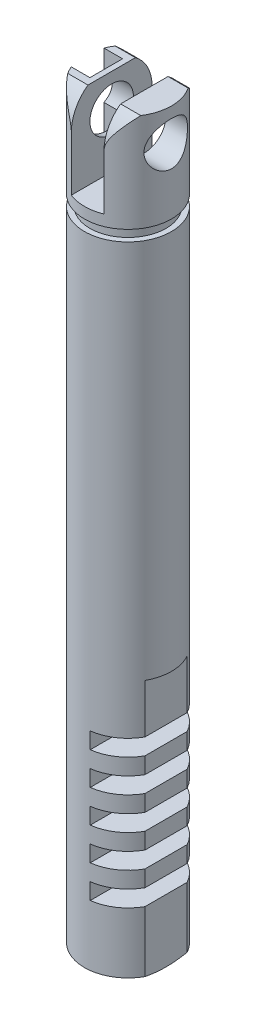
from build123d import *

# Parameters (mm, degrees)
SKETCH1_R               = 4
BOSS_EXTRUDE1_DEPTH     = 70
SKETCH6_W               = 4.328496888
SKETCH6_H               = 9.579040451
CUT_EXTRUDE1_DEPTH      = 25
SKETCH9_W               = 3.5
SKETCH9_H               = 1.5
CUT_EXTRUDE3_DEPTH      = 71.228199464
LPATTERN1_COUNT         = 5
LPATTERN1_PITCH         = 3
SKETCH11_R              = 5.104330264
SKETCH11_R_2            = 3.5
CUT_EXTRUDE4_DEPTH      = 1
SKETCH13_W              = 3.424884294
SKETCH13_H              = 3
CUT_EXTRUDE5_DEPTH      = 30
SKETCH16_W              = 3
SKETCH16_H              = 11.255026014
CUT_EXTRUDE6_DEPTH      = 8
CUT_EXTRUDE7_DEPTH      = 71.370448343
CUT_EXTRUDE7_DEPTH_BACK = 71.370448343
SKETCH17_R              = 2
CUT_EXTRUDE8_DEPTH      = 71.228199575
CUT_EXTRUDE8_DEPTH_BACK = 71.228199575


with BuildPart() as part:
    # Sketch1 → Boss-Extrude1 (new body)
    with BuildSketch(Plane(origin=(0, 0, 0), x_dir=(1, 0, 0), z_dir=(0, 1, 0))):
        Circle(SKETCH1_R)
    extrude(amount=BOSS_EXTRUDE1_DEPTH)

    # Sketch6 → Cut-Extrude1 (cut)
    with BuildSketch(Plane.XZ):
        with Locations((5.664248444, 0.051224815)):
            Rectangle(SKETCH6_W, SKETCH6_H)
    extrude(amount=-CUT_EXTRUDE1_DEPTH, mode=Mode.SUBTRACT)

    # Sketch9 → Cut-Extrude3 (cut, symmetric)
    with BuildSketch(Plane.XY):
        with Locations((2.25, 7.75)):
            Rectangle(SKETCH9_W, SKETCH9_H)
    cut_extrude3 = extrude(amount=CUT_EXTRUDE3_DEPTH, both=True, mode=Mode.SUBTRACT)

    # LPattern1: Cut-Extrude3 ×5
    with Locations(*[(0, i * LPATTERN1_PITCH, 0) for i in range(1, LPATTERN1_COUNT)]):
        add(cut_extrude3, mode=Mode.SUBTRACT)

    # Sketch11 → Cut-Extrude4 (cut)
    with BuildSketch(Plane.XZ.offset(-60)):
        Circle(SKETCH11_R)
        Circle(SKETCH11_R_2, mode=Mode.SUBTRACT)
    extrude(amount=-CUT_EXTRUDE4_DEPTH, mode=Mode.SUBTRACT)

    # Sketch12 → Cut-Revolve4 (revolve, cut)
    with BuildSketch(Plane.XY):
        Polygon((-4, 1.426267284), (-4, 0), (-0.375954547, 0), align=None)
    revolve(axis=Axis((0, 60, 0), (0, -1, 0)), mode=Mode.SUBTRACT)

    # Sketch13 → Cut-Extrude5 (cut)
    with BuildSketch(Plane(origin=(0, 70, 0), x_dir=(1, 0, 0), z_dir=(0, 1, 0))):
        with Locations((-3.712442147, 0)):
            Rectangle(SKETCH13_W, SKETCH13_H)
    extrude(amount=-CUT_EXTRUDE5_DEPTH, mode=Mode.SUBTRACT)

    # Sketch16 → Cut-Extrude6 (cut)
    with BuildSketch(Plane(origin=(0, 70, 0), x_dir=(1, 0, 0), z_dir=(0, 1, 0))):
        Rectangle(SKETCH16_W, SKETCH16_H)
    extrude(amount=-CUT_EXTRUDE6_DEPTH, mode=Mode.SUBTRACT)

    # Sketch17 → Cut-Extrude7 (cut, two sides: drawn at the far end of the back side and taken through both)
    with BuildSketch(Plane.ZY.offset(2).offset(-CUT_EXTRUDE7_DEPTH_BACK)):
        with Locations((0, 67)):
            Circle(SKETCH17_R)
    extrude(amount=CUT_EXTRUDE7_DEPTH + CUT_EXTRUDE7_DEPTH_BACK, mode=Mode.SUBTRACT)

    # Sketch18 → Cut-Extrude8 (cut, two sides: drawn at the far end of the back side and taken through both)
    with BuildSketch(Plane(origin=(0, 0, 0), x_dir=(0, 0, -1), z_dir=(1, 0, 0)).offset(-CUT_EXTRUDE8_DEPTH_BACK)):
        with BuildLine():
            Line((3.708099244, 67), (5.27482694, 67))
            ThreePointArc((5.27482694, 67), (-0.019969421, 72.27478914), (-5.27467574, 66.960061445))
            Line((-5.27467574, 66.960061445), (-3.708099244, 67))
            ThreePointArc((-3.708099244, 67), (0, 70.708099244), (3.708099244, 67))
        make_face()
    extrude(amount=CUT_EXTRUDE8_DEPTH + CUT_EXTRUDE8_DEPTH_BACK, mode=Mode.SUBTRACT)


solid = part.part
